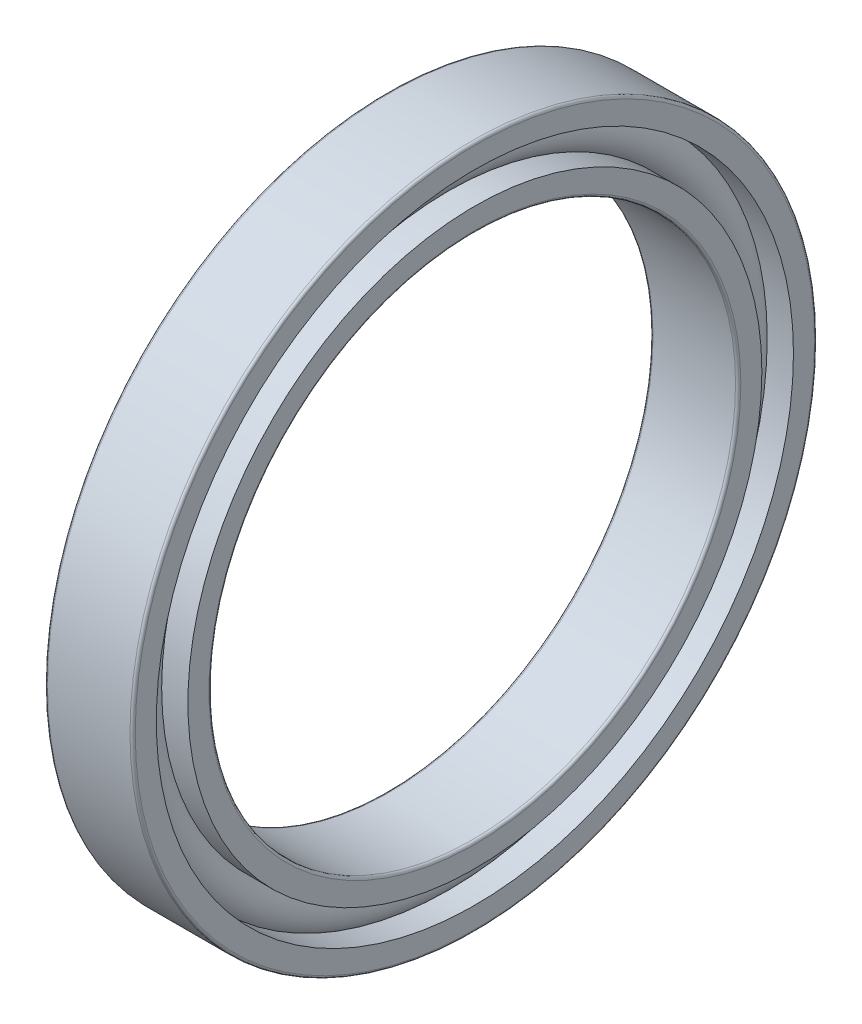
from build123d import *

# Parameters (mm, degrees)
CAGSPISKE_W     = 0.54
CAGSPISKE_H     = 0.9
CAGESPINE_ANGLE = 0.001
BALSIMSKE_R     = 2.7


with BuildPart() as part:
    # CagSpiSke → CageSpine (revolve)
    with BuildSketch(Plane.XY):
        with Locations((0, 34.5)):
            Rectangle(CAGSPISKE_W, CAGSPISKE_H)
    revolve(axis=Axis((-20.6375, 0, 0), (-1, 0, 0)), revolution_arc=CAGESPINE_ANGLE)

    # BalSimSke → BallsSimplified (revolve)
    with BuildSketch(Plane.XY):
        with Locations((0, 34.5)):
            Circle(BALSIMSKE_R)
    revolve(axis=Axis((-10, 0, 0), (1, 0, 0)))

    # InnRacSke → InnerRace (revolve)
    with BuildSketch(Plane.XY):
        with BuildLine():
            Line((-1.978793825, 32.7), (-5, 32.7))
            Line((-5, 32.7), (-5, 30.3))
            ThreePointArc((-5, 30.3), (-4.912132034, 30.087867966), (-4.7, 30))
            Line((-4.7, 30), (4.7, 30))
            ThreePointArc((4.7, 30), (4.912132034, 30.087867966), (5, 30.3))
            Line((5, 30.3), (5, 32.7))
            Line((5, 32.7), (1.978793825, 32.7))
            ThreePointArc((1.978793825, 32.7), (0, 31.825), (-1.978793825, 32.7))
        make_face()
    revolve(axis=Axis((-20.6375, 0, 0), (1, 0, 0)))

    # OutRacSke → OuterRace (revolve)
    with BuildSketch(Plane.XY):
        with BuildLine():
            Line((-1.978793825, 36.3), (-5, 36.3))
            Line((-5, 36.3), (-5, 38.7))
            ThreePointArc((-5, 38.7), (-4.912132034, 38.912132034), (-4.7, 39))
            Line((-4.7, 39), (4.7, 39))
            ThreePointArc((4.7, 39), (4.912132034, 38.912132034), (5, 38.7))
            Line((5, 38.7), (5, 36.3))
            Line((5, 36.3), (1.978793825, 36.3))
            ThreePointArc((1.978793825, 36.3), (0, 37.175), (-1.978793825, 36.3))
        make_face()
    revolve(axis=Axis((-20.6375, 0, 0), (1, 0, 0)))


solid = part.part
